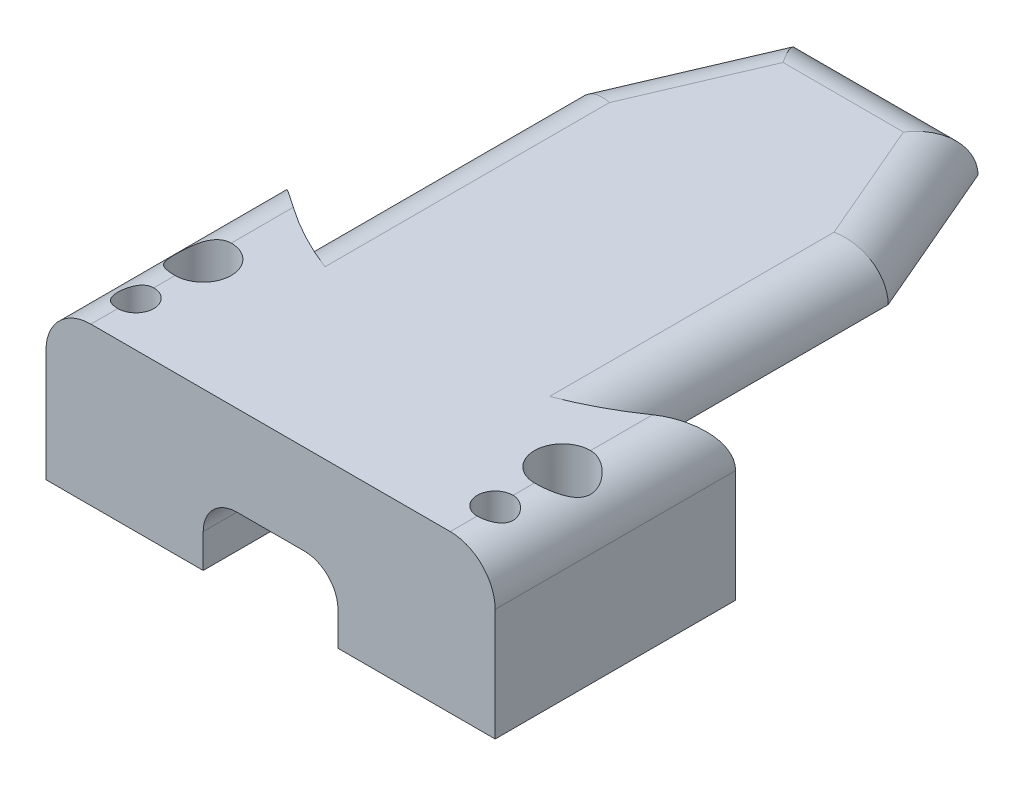
from build123d import *

# Parameters (mm, degrees)
BOSS_EXTRUDE1_DEPTH = 7
BOSS_EXTRUDE2_DEPTH = 2
CUT_EXTRUDE1_START  = 6.5
CUT_EXTRUDE1_DEPTH  = 31.789915603
FILLET1_R           = 2
SKETCH2_R           = 0.8
SCREW_HOLES_DEPTH   = 25.289915673
SKETCH4_R           = 1.25
SCREW_HEADS_DEPTH   = 3


with BuildPart() as part:
    # Sketch5 → Boss-Extrude1 (new body)
    with BuildSketch(Plane(origin=(0, 0, 0), x_dir=(1, 0, 0), z_dir=(0, 1, 0))):
        with BuildLine():
            Line((-10, -6.5), (10, -6.5))
            Line((10, -6.5), (10, 4.202041029))
            ThreePointArc((10, 4.202041029), (0, 0), (-10, 4.202041029))
            Line((-10, 4.202041029), (-10, -6.5))
        make_face()
    extrude(amount=-BOSS_EXTRUDE1_DEPTH)

    # Sketch6 → Boss-Extrude2 (add)
    with BuildSketch(Plane(origin=(0, 0, 0), x_dir=(1, 0, 0), z_dir=(0, 1, 0))):
        Polygon((-7, 14), (-7, 0), (7, 0), (7, 14), (4, 21), (0, 21), (-4, 21), align=None)
    extrude(amount=-BOSS_EXTRUDE2_DEPTH)

    # Sketch3 → Cut-Extrude1 (cut, through all)
    with BuildSketch(Plane.XY.offset(CUT_EXTRUDE1_START)):
        with BuildLine():
            Line((3, -7), (3, -5.5))
            ThreePointArc((3, -5.5), (2.560660172, -4.439339828), (1.5, -4))
            Line((1.5, -4), (-1.5, -4))
            ThreePointArc((-1.5, -4), (-2.560660172, -4.439339828), (-3, -5.5))
            Line((-3, -5.5), (-3, -7))
            Line((-3, -7), (0, -7))
            Line((0, -7), (3, -7))
        make_face()
    extrude(amount=-CUT_EXTRUDE1_DEPTH, mode=Mode.SUBTRACT)

    # Fillet1
    fillet1_edges = [part.edges().sort_by_distance(p)[0] for p in [
        (10, 0, 1.148979486),
        (-10, 0, 1.148979486),
        (7, 0, -7.937822174),
        (-7, 0, -7.937822174),
        (0, 0, -21),
        (-5.5, 0, -17.5),
        (5.5, 0, -17.5),
    ]]
    fillet(fillet1_edges, radius=FILLET1_R - 0.0001)  # a hair under: the kernel refuses the full size

    # Sketch2 → Screw Holes (cut, through all)
    with BuildSketch(Plane(origin=(0, 0, 0), x_dir=(1, 0, 0), z_dir=(0, 1, 0))):
        with Locations(Location((-8, -1.5, 0), (0, 0, 270))):
            Circle(SKETCH2_R)
        with Locations(Location((8, -1.5, 0), (0, 0, 270))):
            Circle(SKETCH2_R)
        with Locations(Location((8, -4.5, 0), (0, 0, 270))):
            Circle(SKETCH2_R)
        with Locations(Location((-8, -4.5, 0), (0, 0, 270))):
            Circle(SKETCH2_R)
    extrude(amount=-SCREW_HOLES_DEPTH, mode=Mode.SUBTRACT)

    # Sketch4 → Screw Heads (cut)
    with BuildSketch(Plane(origin=(0, 0, 0), x_dir=(1, 0, 0), z_dir=(0, 1, 0))):
        with Locations(Location((-8, -1.5, 0), (0, 0, 270))):
            Circle(SKETCH4_R)
        with Locations(Location((8, -1.5, 0), (0, 0, 270))):
            Circle(SKETCH4_R)
    extrude(amount=-SCREW_HEADS_DEPTH, mode=Mode.SUBTRACT)


solid = part.part
